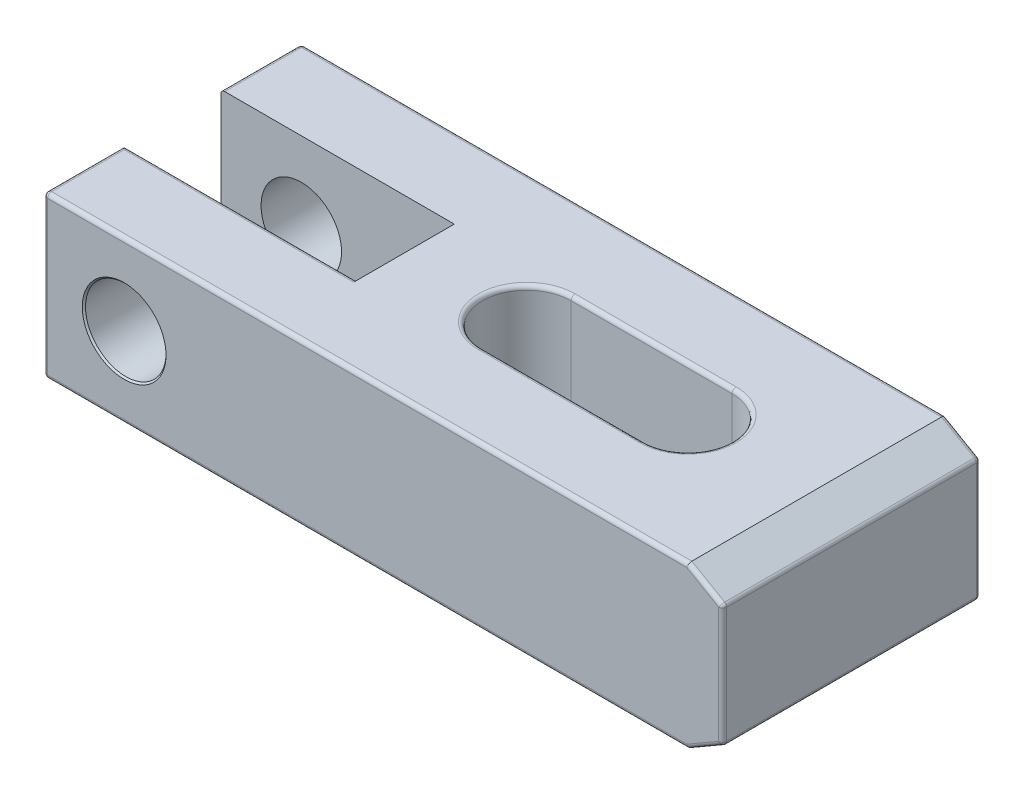
from build123d import *

# Parameters (mm, degrees)
BASE_BRIDE_DEPTH          = 32
CONG_BRIDE1_R             = 0.5
ESQUISSE_ENL_V_MAT_BRID_W = 29
ESQUISSE_ENL_V_MAT_BRID_H = 12
ENL_V_MATI_RE_BRIDE_DEPTH = 59.216493896
CONG_BRIDE2_R             = 0.5
ESQUISSE_PERCAGE_BRIDE_R  = 5
PERCAGE_BRIDE_DEPTH       = 56.580213759
CHANFREIN_BRIDE_SIZE      = 0.2


with BuildPart() as part:
    # esquisse_base_bride → Base_bride (new body)
    with BuildSketch(Plane.XY):
        Polygon((40, 10), (44.330127019, 7.5), (44.330127019, -7.5), (40, -10), (-40, -10), (-40, 10), align=None)
    extrude(amount=BASE_BRIDE_DEPTH)

    # congé_bride1
    cong_bride1_edges = [part.edges().sort_by_distance(p)[0] for p in [
        (42.165063509, -8.75, 32),
        (-40, 10, 16),
        (44.330127019, 7.5, 16),
        (44.330127019, -7.5, 16),
        (-40, -10, 16),
        (44.330127019, 0, 32),
        (42.165063509, 8.75, 32),
        (0, 10, 32),
        (-40, 0, 32),
        (0, 10, 0),
        (42.165063509, 8.75, 0),
        (44.330127019, 0, 0),
        (0, -10, 32),
        (42.165063509, -8.75, 0),
        (0, -10, 0),
        (-40, 0, 0),
    ]]
    fillet(cong_bride1_edges, radius=CONG_BRIDE1_R)

    # esquisse_enlèv.mat.brid → enlèv.matière_bride (cut, through all)
    with BuildSketch(Plane(origin=(0, 10, 0), x_dir=(1, 0, 0), z_dir=(0, 1, 0))):
        with Locations((-25.5, -16)):
            Rectangle(ESQUISSE_ENL_V_MAT_BRID_W, ESQUISSE_ENL_V_MAT_BRID_H)
        with BuildLine():
            Line((4, -10.5), (24, -10.5))
            ThreePointArc((24, -10.5), (29.5, -16), (24, -21.5))
            Line((24, -21.5), (4, -21.5))
            ThreePointArc((4, -21.5), (-1.5, -16), (4, -10.5))
        make_face()
    extrude(amount=-ENL_V_MATI_RE_BRIDE_DEPTH, mode=Mode.SUBTRACT)

    # congé_bride2
    # the kernel refuses this fillet: 0.5 mm, written as the material it takes off along each edge
    with BuildSketch(Plane(origin=(-40.75, -10, 22), x_dir=(0, 1, 0), z_dir=(1, 0, 0))) as cong_bride2_piece_1:
        with BuildLine():
            CenterArc((CONG_BRIDE2_R, CONG_BRIDE2_R), CONG_BRIDE2_R, 180, 90)
            Line((0, CONG_BRIDE2_R), (0, 0))
            Line((0, 0), (CONG_BRIDE2_R, 0))
        make_face()
    extrude(amount=29.75, mode=Mode.SUBTRACT)
    with BuildSketch(Plane(origin=(-11, 10, 22), x_dir=(0, 0, 1), z_dir=(-1, 0, 0))) as cong_bride2_piece_2:
        with BuildLine():
            CenterArc((CONG_BRIDE2_R, -CONG_BRIDE2_R), CONG_BRIDE2_R, 90, 90)
            Line((0, -CONG_BRIDE2_R), (0, 0))
            Line((0, 0), (CONG_BRIDE2_R, 0))
        make_face()
    extrude(amount=29.75, mode=Mode.SUBTRACT)
    with BuildSketch(Plane(origin=(24, 10, 16), x_dir=(0, 0, -1), z_dir=(-1, 0, 0))) as cong_bride2_piece_3:
        with BuildLine():
            CenterArc((5.5 + CONG_BRIDE2_R, CONG_BRIDE2_R), CONG_BRIDE2_R, 180, 90)
            Line((5.5, CONG_BRIDE2_R), (5.5, 0))
            Line((5.5, 0), (5.5 + CONG_BRIDE2_R, 0))
        make_face()
    revolve(axis=Axis((24, 10, 16), (0, -1, 0)), revolution_arc=180, mode=Mode.SUBTRACT)
    with BuildSketch(Plane(origin=(4, 10, 10.5), x_dir=(0, 0, -1), z_dir=(1, 0, 0)), Plane(origin=(24, 10, 21.5), x_dir=(0, 0, 1), z_dir=(-1, 0, 0))) as cong_bride2_piece_4:
        with BuildLine():
            CenterArc((CONG_BRIDE2_R, -CONG_BRIDE2_R), CONG_BRIDE2_R, 90, 90)
            Line((0, -CONG_BRIDE2_R), (0, 0))
            Line((0, 0), (CONG_BRIDE2_R, 0))
        make_face()
    extrude(amount=20, mode=Mode.SUBTRACT)
    with BuildSketch(Plane(origin=(4, 10, 16), x_dir=(0, 0, 1), z_dir=(1, 0, 0))) as cong_bride2_piece_5:
        with BuildLine():
            CenterArc((5.5 + CONG_BRIDE2_R, CONG_BRIDE2_R), CONG_BRIDE2_R, 180, 90)
            Line((5.5, CONG_BRIDE2_R), (5.5, 0))
            Line((5.5, 0), (5.5 + CONG_BRIDE2_R, 0))
        make_face()
    revolve(axis=Axis((4, 10, 16), (0, -1, 0)), revolution_arc=180, mode=Mode.SUBTRACT)
    with BuildSketch(Plane(origin=(24, -10, 16), x_dir=(0, 0, 1), z_dir=(-1, 0, 0))) as cong_bride2_piece_6:
        with BuildLine():
            CenterArc((5.5 + CONG_BRIDE2_R, CONG_BRIDE2_R), CONG_BRIDE2_R, 180, 90)
            Line((5.5 + CONG_BRIDE2_R, 0), (5.5, 0))
            Line((5.5, 0), (5.5, CONG_BRIDE2_R))
        make_face()
    revolve(axis=Axis((24, -10, 16), (0, 1, 0)), revolution_arc=180, mode=Mode.SUBTRACT)
    with BuildSketch(Plane(origin=(24, -10, 10.5), x_dir=(0, 1, 0), z_dir=(-1, 0, 0)), Plane(origin=(4, -10, 21.5), x_dir=(0, 1, 0), z_dir=(1, 0, 0))) as cong_bride2_piece_7:
        with BuildLine():
            CenterArc((CONG_BRIDE2_R, CONG_BRIDE2_R), CONG_BRIDE2_R, 180, 90)
            Line((0, CONG_BRIDE2_R), (0, 0))
            Line((0, 0), (CONG_BRIDE2_R, 0))
        make_face()
    extrude(amount=20, mode=Mode.SUBTRACT)
    with BuildSketch(Plane(origin=(4, -10, 16), x_dir=(0, 0, -1), z_dir=(1, 0, 0))) as cong_bride2_piece_8:
        with BuildLine():
            CenterArc((5.5 + CONG_BRIDE2_R, CONG_BRIDE2_R), CONG_BRIDE2_R, 180, 90)
            Line((5.5 + CONG_BRIDE2_R, 0), (5.5, 0))
            Line((5.5, 0), (5.5, CONG_BRIDE2_R))
        make_face()
    revolve(axis=Axis((4, -10, 16), (0, 1, 0)), revolution_arc=180, mode=Mode.SUBTRACT)

    # esquisse_percage_bride → percage_bride (cut, through all)
    with BuildSketch(Plane.XY.offset(32)):
        with Locations((-30, 0)):
            Circle(ESQUISSE_PERCAGE_BRIDE_R)
    extrude(amount=-PERCAGE_BRIDE_DEPTH, mode=Mode.SUBTRACT)

    # chanfrein_bride
    chanfrein_bride_edges = [part.edges().sort_by_distance(p)[0] for p in [
        (-35, 0, 0),
        (-35, 0, 22),
        (-35, 0, 32),
    ]]
    chamfer(chanfrein_bride_edges, length=CHANFREIN_BRIDE_SIZE)


solid = part.part
